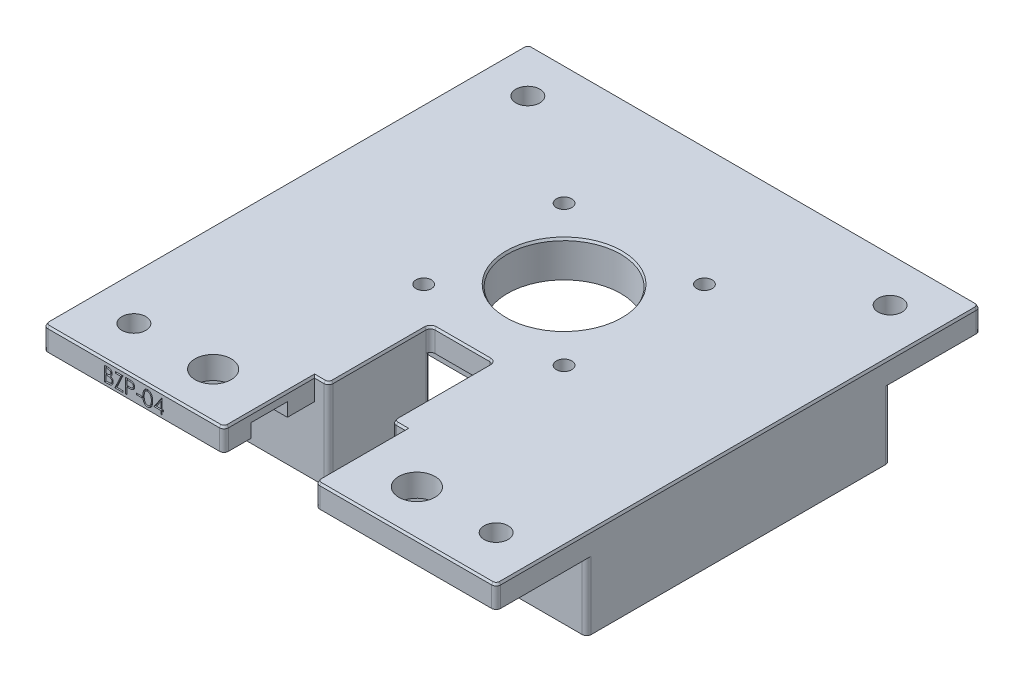
from build123d import *
from OCP.BRepFilletAPI import BRepFilletAPI_MakeChamfer

# Parameters (mm, degrees)
SKETCH2_W                  = 100
SKETCH2_H                  = 107
BOSS_EXTRUDE1_DEPTH        = 5
CUT_EXTRUDE1_DEPTH         = 147.540096902
CUT_EXTRUDE1_DEPTH_BACK    = 147.540096902
SKETCH3_R                  = 12.5
SKETCH3_R_2                = 1.7
SKETCH3_R_3                = 4
M5_CLEARANCE_HOLE1_D       = 5.3
FILLET1_R                  = 1
BOSS_EXTRUDE2_DEPTH        = 15
FILLET3_R                  = 3
FILLET4_R                  = 1
CUT_EXTRUDE2_DEPTH         = 4
CUT_EXTRUDE2_DEPTH_BACK    = 4
SKETCH12_R                 = 12.5
SKETCH12_R_2               = 1.7
BOSS_EXTRUDE3_DEPTH        = 3
CHAMFER2_SIZE              = 0.5
SKETCH10_W                 = 1.221153846
SKETCH10_H                 = 0.325641026
PART_NUM_DEPTH             = 0.4
PRINTABILITY_CHAMFER_SIZE  = 0.5
PRINTABILITY_CHAMFER_SIZE2 = 0.288675135


with BuildPart() as part:
    # Sketch2 → Boss-Extrude1 (new body)
    with BuildSketch(Plane(origin=(0, 0, 0), x_dir=(1, 0, 0), z_dir=(0, 1, 0))):
        with Locations((50, 53.5)):
            Rectangle(SKETCH2_W, SKETCH2_H)
    extrude(amount=BOSS_EXTRUDE1_DEPTH)

    # Sketch3 → Cut-Extrude1 (cut, two sides: drawn at the far end of the back side and taken through both)
    with BuildSketch(Plane(origin=(0, 5, 0), x_dir=(1, 0, 0), z_dir=(0, 1, 0)).offset(-CUT_EXTRUDE1_DEPTH_BACK)):
        with Locations((50, 65)):
            Circle(SKETCH3_R)
        with Locations((65.5, 49.5)):
            Circle(SKETCH3_R_2)
        with Locations((34.5, 49.5)):
            Circle(SKETCH3_R_2)
        with Locations((65.5, 80.5)):
            Circle(SKETCH3_R_2)
        with Locations((34.5, 80.5)):
            Circle(SKETCH3_R_2)
        with Locations((27.5, 10)):
            Circle(SKETCH3_R_3)
        with Locations((72.5, 10)):
            Circle(SKETCH3_R_3)
        Polygon((39.9, 0), (39.9, 20), (43, 20), (43, 42.5), (57, 42.5), (57, 20), (60.1, 20), (60.1, 0), align=None)
    extrude(amount=CUT_EXTRUDE1_DEPTH + CUT_EXTRUDE1_DEPTH_BACK, mode=Mode.SUBTRACT)

    # M5 Clearance Hole1 (through all)
    with Locations(Plane(origin=(0, 5, 0), x_dir=(1, 0, 0), z_dir=(0, 1, 0))):
        with Locations((10, 97), (10, 10), (90, 10), (90, 97)):
            Hole(M5_CLEARANCE_HOLE1_D / 2)

    # Fillet1
    fillet1_edges = [part.edges().sort_by_distance(p)[0] for p in [
        (60.1, 2.5, 0),
        (39.9, 2.5, 0),
        (0, 2.5, -107),
        (100, 2.5, -107),
        (100, 2.5, 0),
        (0, 2.5, 0),
        (57, 2.5, -42.5),
        (43, 2.5, -42.5),
    ]]
    fillet(fillet1_edges, radius=FILLET1_R)

    # Sketch7 → Boss-Extrude2 (add)
    with BuildSketch(Plane.XZ):
        Polygon((57, -20), (100, -20), (100, -87), (84, -87), (84, -82), (95, -82), (95, -25), (62, -25), (62, -42.5), (57, -42.5), (57, -25), align=None)
        Polygon((43, -25), (43, -20), (0, -20), (0, -87), (16, -87), (16, -82), (5, -82), (5, -25), (38, -25), (38, -42.5), (43, -42.5), align=None)
    extrude(amount=BOSS_EXTRUDE2_DEPTH)

    # Fillet3
    fillet3_edges = [part.edges().sort_by_distance(p)[0] for p in [
        (5, -7.5, -82),
        (95, -7.5, -82),
        (5, -7.5, -25),
        (38, -7.5, -25),
        (95, -7.5, -25),
        (62, -7.5, -25),
    ]]
    fillet(fillet3_edges, radius=FILLET3_R)

    # Fillet4
    fillet4_edges = [part.edges().sort_by_distance(p)[0] for p in [
        (100, -7.5, -87),
        (100, -7.5, -20),
        (43, -5, -20),
        (57, -5, -20),
        (84, -7.5, -87),
        (84, -7.5, -82),
        (0, -7.5, -20),
        (0, -7.5, -87),
        (16, -7.5, -87),
        (16, -7.5, -82),
        (38, -7.5, -42.5),
        (62, -7.5, -42.5),
        (57, -7.5, -42.5),
        (43, -7.5, -42.5),
    ]]
    fillet(fillet4_edges, radius=FILLET4_R)

    # Sketch9 → Cut-Extrude2 (cut, two sides: drawn at the far end of the back side and taken through both)
    with BuildSketch(Plane.XY.offset(-10).offset(-CUT_EXTRUDE2_DEPTH_BACK)):
        Polygon((39.9, 0), (39.9, 3), (36.9, 0), align=None)
        Polygon((60.1, 0), (63.1, 0), (60.1, 3), align=None)
    extrude(amount=CUT_EXTRUDE2_DEPTH + CUT_EXTRUDE2_DEPTH_BACK, mode=Mode.SUBTRACT)

    # Sketch12 → Boss-Extrude3 (add)
    with BuildSketch(Plane.XZ):
        with BuildLine():
            Line((34.5, -85.5), (65.5, -85.5))
            ThreePointArc((65.5, -85.5), (69.035533906, -84.035533906), (70.5, -80.5))
            Line((70.5, -80.5), (70.5, -49.5))
            ThreePointArc((70.5, -49.5), (69.035533906, -45.964466094), (65.5, -44.5))
            Line((65.5, -44.5), (34.5, -44.5))
            ThreePointArc((34.5, -44.5), (30.964466094, -45.964466094), (29.5, -49.5))
            Line((29.5, -49.5), (29.5, -80.5))
            ThreePointArc((29.5, -80.5), (30.964466094, -84.035533906), (34.5, -85.5))
        make_face()
        with Locations((50, -65)):
            Circle(SKETCH12_R, mode=Mode.SUBTRACT)
        with Locations((34.5, -49.5)):
            Circle(SKETCH12_R_2, mode=Mode.SUBTRACT)
        with Locations((65.5, -49.5)):
            Circle(SKETCH12_R_2, mode=Mode.SUBTRACT)
        with Locations((65.5, -80.5)):
            Circle(SKETCH12_R_2, mode=Mode.SUBTRACT)
        with Locations((34.5, -80.5)):
            Circle(SKETCH12_R_2, mode=Mode.SUBTRACT)
    extrude(amount=BOSS_EXTRUDE3_DEPTH)

    # Chamfer2
    chamfer2_edges = [part.edges().sort_by_distance(p)[0] for p in [
        (50, 0, -85.5),
        (69.035533906, 0, -84.035533906),
        (30.964466094, 0, -84.035533906),
        (70.5, 0, -65),
        (29.5, 0, -65),
        (69.035533906, 0, -45.964466094),
        (30.964466094, 0, -45.964466094),
        (50, 0, -44.5),
    ]]
    chamfer(chamfer2_edges, length=CHAMFER2_SIZE)

    # Sketch10 → Part Num (cut)
    # profile 1 of 6: a face of its own
    with BuildSketch(Plane(origin=(0, 5, 0), x_dir=(1, 0, 0), z_dir=(0, 0, -1))):
        with BuildLine():
            Line((13.559294872, 1.225), (14.178776042, 1.225))
            add(Edge.make_bspline(
                [(14.178776042, 1.225), (14.209100925, 1.225156921), (14.267878096, 1.225461072), (14.353342091, 1.230287737), (14.433418884, 1.236704332), (14.50796697, 1.247467824), (14.577471422, 1.258628146), (14.641226624, 1.275008826), (14.699766605, 1.293101885), (14.77006114, 1.32094051), (14.849819923, 1.364174247), (14.93554569, 1.428293986), (15.010063757, 1.505168377), (15.073426203, 1.592772808), (15.124275913, 1.68914761), (15.160598035, 1.792219247), (15.18393275, 1.900253662), (15.186302411, 1.974321243), (15.1875, 2.011753806)],
                knots=[0, 0, 0, 0, 1.00128172, 1.940733171, 2.826250472, 3.653024905, 4.427672124, 5.149348099, 5.824709082, 6.450061444, 7.643590664, 8.808605388, 9.972104426, 11.165284501, 12.367876273, 13.557044126, 14.765369432, 16, 16, 16, 16], degree=3))
            add(Edge.make_bspline(
                [(15.1875, 2.011753806), (15.186521793, 2.046821674), (15.184599523, 2.115733341), (15.165820503, 2.216186738), (15.137474028, 2.312110727), (15.096568342, 2.402580893), (15.044410156, 2.486802276), (14.980951884, 2.563338275), (14.905707767, 2.630686236), (14.849214068, 2.668166335), (14.820517829, 2.687204527)],
                knots=[0, 0, 0, 0, 1.044356178, 2.052258378, 3.035953355, 4.020338374, 5.002448483, 5.980768927, 6.974322109, 8, 8, 8, 8], degree=3))
            add(Edge.make_bspline(
                [(14.820517829, 2.687204527), (14.856588776, 2.701045853), (14.925601434, 2.727527739), (15.020694663, 2.77452874), (15.102651573, 2.825257679), (15.172528364, 2.880086384), (15.231080178, 2.940805168), (15.283240485, 3.005814962), (15.327507334, 3.077379834), (15.365276832, 3.153949009), (15.395196276, 3.235117005), (15.415964531, 3.320276589), (15.429135825, 3.40846321), (15.430858211, 3.468399436), (15.431730769, 3.498763021)],
                knots=[0, 0, 0, 0, 1.272200328, 2.434034374, 3.488177493, 4.442517805, 5.351202203, 6.260825393, 7.183200622, 8.11705787, 9.069326169, 10.026320267, 11.000137371, 12, 12, 12, 12], degree=3))
            add(Edge.make_bspline(
                [(15.431730769, 3.498763021), (15.430844545, 3.529757203), (15.429100875, 3.590739126), (15.41623883, 3.680324877), (15.394454675, 3.765933729), (15.364470848, 3.848135531), (15.325385419, 3.926448851), (15.27816616, 4.001489144), (15.22149309, 4.072144303), (15.157673639, 4.13943962), (15.086469492, 4.20097828), (15.008008094, 4.253862582), (14.924300327, 4.299540927), (14.834199915, 4.336263754), (14.73834618, 4.365011011), (14.636716669, 4.384886817), (14.529369089, 4.398332925), (14.455699174, 4.399434879), (14.41791867, 4.4)],
                knots=[0, 0, 0, 0, 0.978522333, 1.925270105, 2.85076145, 3.763600118, 4.682725947, 5.609499657, 6.557784645, 7.537954401, 8.534920712, 9.522742111, 10.520247711, 11.5409147, 12.58930695, 13.675078472, 14.807699069, 16, 16, 16, 16], degree=3))
            Line((14.41791867, 4.4), (13.559294872, 4.4))
            Line((13.559294872, 4.4), (13.559294872, 1.225))
        make_face()
        with BuildLine():
            Line((13.844230769, 1.550641026), (13.844230769, 2.568269231))
            Line((13.844230769, 2.568269231), (14.035672075, 2.568269231))
            add(Edge.make_bspline(
                [(14.035672075, 2.568269231), (14.063656592, 2.567909462), (14.11772838, 2.567214317), (14.196240951, 2.565160292), (14.26893695, 2.559660798), (14.336066859, 2.553844164), (14.397180797, 2.544887778), (14.452483186, 2.53392756), (14.502471365, 2.522437825), (14.560090796, 2.502841292), (14.625441111, 2.474182831), (14.694618633, 2.428618136), (14.756881512, 2.375864071), (14.808244794, 2.313289506), (14.85100659, 2.245714635), (14.879796447, 2.172635549), (14.899869806, 2.096570575), (14.901656804, 2.044112234), (14.902564103, 2.017477965)],
                knots=[0, 0, 0, 0, 1.156584208, 2.234756387, 3.244705828, 4.168772894, 5.018724976, 5.795346628, 6.498686023, 7.135894168, 8.308330183, 9.43588092, 10.547699294, 11.667188675, 12.76860303, 13.837480448, 14.902040606, 16, 16, 16, 16], degree=3))
            add(Edge.make_bspline(
                [(14.902564103, 2.017477965), (14.902121598, 1.999845497), (14.901253578, 1.965257486), (14.893070408, 1.914864741), (14.88177773, 1.866910763), (14.863153292, 1.822688306), (14.841088146, 1.780644538), (14.8128059, 1.742107543), (14.780193868, 1.706033348), (14.742172327, 1.673388889), (14.698896699, 1.64386386), (14.648996117, 1.619285683), (14.593827254, 1.597443357), (14.532239669, 1.580886362), (14.465460128, 1.566512255), (14.392469815, 1.557448022), (14.313708618, 1.551625016), (14.259137987, 1.550976338), (14.230929487, 1.550641026)],
                knots=[0, 0, 0, 0, 0.911412742, 1.787835618, 2.63643285, 3.453173233, 4.262886967, 5.08783453, 5.918594724, 6.773969545, 7.67442701, 8.62112486, 9.645634318, 10.739428598, 11.916091468, 13.177237585, 14.540865421, 16, 16, 16, 16], degree=3))
            Line((14.230929487, 1.550641026), (13.844230769, 1.550641026))
        make_face(mode=Mode.SUBTRACT)
        with BuildLine():
            Line((13.844230769, 2.893910256), (13.844230769, 4.074358974))
            Line((13.844230769, 4.074358974), (14.250010016, 4.074358974))
            add(Edge.make_bspline(
                [(14.250010016, 4.074358974), (14.279052852, 4.073977387), (14.335029091, 4.073241928), (14.415910647, 4.071496784), (14.490477252, 4.065022306), (14.55934975, 4.058814977), (14.622209475, 4.048674015), (14.679667845, 4.038854064), (14.730412484, 4.024403522), (14.789786642, 4.00451932), (14.856196042, 3.97274173), (14.92871824, 3.926010062), (14.99259521, 3.869087446), (15.046790344, 3.803544285), (15.091851221, 3.733014359), (15.123024449, 3.657358853), (15.143222926, 3.579104783), (15.145601826, 3.52559752), (15.146794872, 3.498763021)],
                knots=[0, 0, 0, 0, 1.16016216, 2.236059617, 3.229676189, 4.14889023, 4.996733752, 5.772278665, 6.474820656, 7.101410824, 8.271817372, 9.403828207, 10.537358096, 11.673541442, 12.791884111, 13.865947414, 14.929748409, 16, 16, 16, 16], degree=3))
            add(Edge.make_bspline(
                [(15.146794872, 3.498763021), (15.146551335, 3.481984403), (15.146068189, 3.448697807), (15.138473614, 3.399825141), (15.127934288, 3.352248989), (15.11240228, 3.306615593), (15.093612775, 3.262139153), (15.06882463, 3.220266851), (15.040863787, 3.17921625), (14.997556668, 3.126707986), (14.933707118, 3.066939881), (14.842942728, 3.009154389), (14.740317485, 2.961797377), (14.665709188, 2.941777202), (14.62716847, 2.931435296)],
                knots=[0, 0, 0, 0, 0.723354195, 1.435040621, 2.129761981, 2.824182007, 3.512608497, 4.209435533, 4.920062464, 5.654614313, 7.143585817, 8.671381114, 10.280521501, 12, 12, 12, 12], degree=3))
            add(Edge.make_bspline(
                [(14.62716847, 2.931435296), (14.611720661, 2.928300831), (14.578226627, 2.921504664), (14.523609473, 2.914335298), (14.461047138, 2.907904144), (14.390807025, 2.903271916), (14.31260978, 2.898299301), (14.226480524, 2.896434267), (14.132358367, 2.894157894), (14.067050921, 2.893994914), (14.033128005, 2.893910256)],
                knots=[0, 0, 0, 0, 0.634452549, 1.375623993, 2.216454381, 3.166361212, 4.209414599, 5.370755378, 6.634280627, 8, 8, 8, 8], degree=3))
            Line((14.033128005, 2.893910256), (13.844230769, 2.893910256))
        make_face(mode=Mode.SUBTRACT)
    # profile 2 of 6: a face of its own
    with BuildSketch(Plane(origin=(0, 5, 0), x_dir=(1, 0, 0), z_dir=(0, 0, -1))):
        Polygon((15.920192308, 1.550641026), (15.920192308, 1.225), (17.589102564, 1.225), (16.257281651, 4.074358974), (17.548397436, 4.074358974), (17.548397436, 4.4), (15.798076923, 4.4), (17.129897837, 1.550641026), align=None)
    # profile 3 of 6: a face of its own
    with BuildSketch(Plane(origin=(0, 5, 0), x_dir=(1, 0, 0), z_dir=(0, 0, -1))):
        with BuildLine():
            Line((18.199679487, 1.225), (18.822340745, 1.225))
            add(Edge.make_bspline(
                [(18.822340745, 1.225), (18.865167781, 1.225047077), (18.947226285, 1.22513728), (19.064896371, 1.227872085), (19.171766628, 1.23152487), (19.267606616, 1.236588444), (19.352711219, 1.242572494), (19.426695341, 1.250965415), (19.49014051, 1.259728683), (19.528155646, 1.268638102), (19.545492788, 1.272701322)],
                knots=[0, 0, 0, 0, 1.415646017, 2.712440637, 3.8905458, 4.950247383, 5.884950622, 6.709939814, 7.411656543, 8, 8, 8, 8], degree=3))
            add(Edge.make_bspline(
                [(19.545492788, 1.272701322), (19.56743964, 1.278708558), (19.610816194, 1.290581476), (19.673321301, 1.314358446), (19.732780513, 1.342564145), (19.789442546, 1.374662729), (19.842336712, 1.412170044), (19.89311447, 1.452921295), (19.940710937, 1.498564559), (19.984407421, 1.549039743), (20.024894101, 1.6026933), (20.058784353, 1.660893367), (20.08871078, 1.721620959), (20.112032716, 1.78635876), (20.130364655, 1.854252238), (20.143715825, 1.9254781), (20.152296908, 1.999882695), (20.153111145, 2.050738752), (20.153525641, 2.076627604)],
                knots=[0, 0, 0, 0, 0.999333726, 1.975119402, 2.933498163, 3.889020618, 4.832249799, 5.779334906, 6.747801194, 7.724875447, 8.710438469, 9.696133548, 10.679360639, 11.681339199, 12.714023775, 13.766351759, 14.862936069, 16, 16, 16, 16], degree=3))
            add(Edge.make_bspline(
                [(20.153525641, 2.076627604), (20.153143349, 2.102733159), (20.152395368, 2.15381044), (20.143418023, 2.228534326), (20.131325635, 2.299943151), (20.11273188, 2.367878582), (20.08837902, 2.431937173), (20.059811229, 2.493097862), (20.025354741, 2.550320136), (19.985762645, 2.603811736), (19.941719413, 2.65362287), (19.893411391, 2.699392577), (19.841033604, 2.740852941), (19.784752512, 2.77809691), (19.724019435, 2.810260821), (19.659755482, 2.839069233), (19.591402071, 2.863263695), (19.544101362, 2.875990965), (19.520052083, 2.882461939)],
                knots=[0, 0, 0, 0, 1.121902311, 2.195077645, 3.232258892, 4.234102512, 5.217864754, 6.176164875, 7.132989551, 8.084763148, 9.034132444, 9.988522005, 10.94243251, 11.903244335, 12.886203696, 13.894208494, 14.929344452, 16, 16, 16, 16], degree=3))
            add(Edge.make_bspline(
                [(19.520052083, 2.882461939), (19.500160632, 2.886688777), (19.456567361, 2.895952137), (19.384778108, 2.906363894), (19.301151672, 2.914902673), (19.205972588, 2.922871129), (19.0990189, 2.927093415), (18.980535909, 2.932051068), (18.850122628, 2.934390313), (18.759163431, 2.934538182), (18.711673678, 2.934615385)],
                knots=[0, 0, 0, 0, 0.601372724, 1.317943291, 2.144091499, 3.08771165, 4.142394186, 5.309582461, 6.595334295, 8, 8, 8, 8], degree=3))
            Line((18.711673678, 2.934615385), (18.484615385, 2.934615385))
            Line((18.484615385, 2.934615385), (18.484615385, 4.4))
            Line((18.484615385, 4.4), (18.199679487, 4.4))
            Line((18.199679487, 4.4), (18.199679487, 1.225))
        make_face()
        with BuildLine():
            Line((18.484615385, 1.550641026), (18.484615385, 2.608974359))
            Line((18.484615385, 2.608974359), (19.040494792, 2.615970553))
            add(Edge.make_bspline(
                [(19.040494792, 2.615970553), (19.067636896, 2.61598845), (19.120034167, 2.616022999), (19.195928006, 2.61234584), (19.266170464, 2.608345506), (19.330865252, 2.601876016), (19.389717084, 2.593985255), (19.44286845, 2.583435268), (19.490743523, 2.572674962), (19.545890306, 2.554003923), (19.607660485, 2.525836289), (19.674703005, 2.483764418), (19.73198534, 2.430764439), (19.781136336, 2.370529413), (19.81998684, 2.303449897), (19.848143485, 2.231877993), (19.865329717, 2.156085468), (19.86748988, 2.104277864), (19.868589744, 2.077899639)],
                knots=[0, 0, 0, 0, 1.160501667, 2.240324542, 3.248665471, 4.168823117, 5.020172044, 5.786515869, 6.485785279, 7.116517804, 8.272762037, 9.381837012, 10.485674779, 11.594342068, 12.695271952, 13.786226926, 14.872841088, 16, 16, 16, 16], degree=3))
            add(Edge.make_bspline(
                [(19.868589744, 2.077899639), (19.867440811, 2.052375996), (19.865156875, 2.001638153), (19.84828545, 1.927242072), (19.819688653, 1.856483828), (19.781104663, 1.789935981), (19.733131498, 1.729861051), (19.67698839, 1.678042247), (19.613548837, 1.636100993), (19.554996767, 1.608181099), (19.502597275, 1.591808252), (19.457302681, 1.579987886), (19.405900244, 1.571835631), (19.348876426, 1.564035455), (19.286304234, 1.557739017), (19.217785787, 1.553366568), (19.143549316, 1.550834445), (19.092014254, 1.55070706), (19.065299479, 1.550641026)],
                knots=[0, 0, 0, 0, 1.12039168, 2.227199994, 3.330242575, 4.460839274, 5.593542475, 6.693949254, 7.801736126, 8.92216649, 9.528704869, 10.210659466, 10.975987387, 11.81211542, 12.738540127, 13.736887663, 14.826846554, 16, 16, 16, 16], degree=3))
            Line((19.065299479, 1.550641026), (18.484615385, 1.550641026))
        make_face(mode=Mode.SUBTRACT)
    # profile 4 of 6: a face of its own
    with BuildSketch(Plane(origin=(0, 5, 0), x_dir=(1, 0, 0), z_dir=(0, 0, -1))):
        with Locations((21.130448718, 3.178846154)):
            Rectangle(SKETCH10_W, SKETCH10_H)
    # profile 5 of 6: a face of its own
    with BuildSketch(Plane(origin=(0, 5, 0), x_dir=(1, 0, 0), z_dir=(0, 0, -1))):
        with BuildLine():
            add(Edge.make_bspline(
                [(21.98525641, 2.813772035), (21.98555397, 2.762883691), (21.986131983, 2.664032348), (21.992562193, 2.519991994), (22.00324411, 2.384863731), (22.017883016, 2.258641095), (22.035697459, 2.141291485), (22.059478684, 2.033128559), (22.086523044, 1.933651525), (22.117867421, 1.842536591), (22.153233633, 1.758554174), (22.191732091, 1.680158454), (22.234864124, 1.607443081), (22.280257631, 1.539336681), (22.329501301, 1.476524658), (22.382423887, 1.419289299), (22.438559244, 1.366743659), (22.498172988, 1.319751782), (22.560696927, 1.278804629), (22.62428152, 1.241686961), (22.69074033, 1.212325862), (22.758434115, 1.187218741), (22.827908268, 1.167330508), (22.899193054, 1.15349668), (22.97235244, 1.144841944), (23.021728688, 1.144011104), (23.046769832, 1.143589744)],
                knots=[0, 0, 0, 0, 1.64625301, 3.197870201, 4.6634513, 6.030635694, 7.308242971, 8.501545196, 9.611429483, 10.641742253, 11.616230371, 12.55791849, 13.464870342, 14.34944951, 15.20427819, 16.044004467, 16.869007726, 17.689551165, 18.496129964, 19.285613293, 20.0683943, 20.843080271, 21.620342827, 22.403213977, 23.190190624, 24, 24, 24, 24], degree=3))
            add(Edge.make_bspline(
                [(23.046769832, 1.143589744), (23.072032833, 1.143940127), (23.122297314, 1.144637268), (23.196342984, 1.15444994), (23.269098905, 1.16711544), (23.339461226, 1.187428816), (23.408760362, 1.211736404), (23.475272984, 1.243809882), (23.541347339, 1.278692279), (23.603981757, 1.321245869), (23.665047641, 1.368274589), (23.722290531, 1.421664209), (23.777173708, 1.479937166), (23.827624258, 1.544393116), (23.875804419, 1.61404376), (23.919885225, 1.68947297), (23.960783476, 1.770513584), (23.99926795, 1.856789911), (24.032921607, 1.950606524), (24.062842398, 2.051378265), (24.087367548, 2.16001767), (24.107649417, 2.275919549), (24.123392008, 2.399658079), (24.134849199, 2.530982551), (24.140903329, 2.669975122), (24.142043239, 2.765005487), (24.142628205, 2.813772035)],
                knots=[0, 0, 0, 0, 0.810910589, 1.61342667, 2.396193133, 3.181089899, 3.963115317, 4.752255436, 5.550715454, 6.36105385, 7.181178335, 8.024612154, 8.872680183, 9.750181803, 10.651284446, 11.591556747, 12.554036451, 13.566402641, 14.62422919, 15.753422176, 16.94128843, 18.199818041, 19.531985927, 20.947085226, 22.433341622, 24, 24, 24, 24], degree=3))
            add(Edge.make_bspline(
                [(24.142628205, 2.813772035), (24.142029642, 2.86232526), (24.140860754, 2.957141006), (24.134986983, 3.0955172), (24.123084878, 3.226125067), (24.108578365, 3.349153833), (24.087662811, 3.46444268), (24.06437755, 3.572610751), (24.034675892, 3.672641678), (24.001820493, 3.765654117), (23.963871504, 3.851564969), (23.923281266, 3.932271074), (23.878542433, 4.007272206), (23.831286761, 4.077364331), (23.779881082, 4.141267492), (23.725740637, 4.200192302), (23.667942403, 4.253674679), (23.606562168, 4.301258682), (23.543335742, 4.344132824), (23.477248506, 4.380259022), (23.409847501, 4.411753694), (23.34043167, 4.437071727), (23.269443657, 4.457085732), (23.196627822, 4.470710162), (23.122287411, 4.48031367), (23.072029521, 4.481043462), (23.046769832, 4.481410256)],
                knots=[0, 0, 0, 0, 1.561431216, 3.049195289, 4.452146966, 5.778046447, 7.031138842, 8.218704273, 9.334037798, 10.384210803, 11.388620812, 12.352076869, 13.287433199, 14.19507451, 15.06813243, 15.922055533, 16.766344942, 17.596869952, 18.417486629, 19.220035357, 20.016159057, 20.807716045, 21.59340902, 22.384936649, 23.188266813, 24, 24, 24, 24], degree=3))
            add(Edge.make_bspline(
                [(23.046769832, 4.481410256), (23.021729561, 4.480985162), (22.972355034, 4.480146959), (22.899183041, 4.471546161), (22.828001615, 4.457521158), (22.758668454, 4.438475275), (22.691041682, 4.414269078), (22.625783708, 4.383479729), (22.562032943, 4.347768738), (22.500079347, 4.307141318), (22.441107289, 4.260581379), (22.384765226, 4.209094936), (22.332527872, 4.151355125), (22.283623806, 4.088283519), (22.237853656, 4.020005674), (22.194904275, 3.946733625), (22.156523059, 3.867574197), (22.120354959, 3.783135875), (22.088472503, 3.691351453), (22.060633331, 3.591533526), (22.037162377, 3.483001243), (22.018467433, 3.365749411), (22.003152106, 3.239959542), (21.992572724, 3.105431183), (21.986135198, 2.962452483), (21.985554685, 2.864236572), (21.98525641, 2.813772035)],
                knots=[0, 0, 0, 0, 0.810976328, 1.599087026, 2.383086309, 3.159618043, 3.926613167, 4.707144544, 5.494386734, 6.292609454, 7.104690378, 7.92621526, 8.762510248, 9.62398222, 10.509836085, 11.424023232, 12.373226806, 13.358118208, 14.398657954, 15.5185989, 16.713620699, 17.994156382, 19.364120462, 20.818119981, 22.365111093, 24, 24, 24, 24], degree=3))
        make_face()
        with BuildLine():
            add(Edge.make_bspline(
                [(22.270192308, 2.8125), (22.270303039, 2.854907579), (22.270517947, 2.937212362), (22.275969792, 3.056603995), (22.283558203, 3.168147672), (22.293104865, 3.271799855), (22.307402335, 3.367198295), (22.323623727, 3.454739556), (22.343080171, 3.534261741), (22.366214564, 3.606459314), (22.392565497, 3.672356193), (22.421290351, 3.733703321), (22.452405577, 3.791246897), (22.486625049, 3.844779303), (22.524439036, 3.894001546), (22.565003515, 3.939147401), (22.608554357, 3.980033045), (22.668828635, 4.02855602), (22.748014823, 4.079288538), (22.848296213, 4.122923324), (22.95138528, 4.150522248), (23.021375705, 4.154022264), (23.056310096, 4.155769231)],
                knots=[0, 0, 0, 0, 1.459193451, 2.832007961, 4.111736495, 5.306635028, 6.412683014, 7.430020708, 8.369596877, 9.227877302, 10.036669781, 10.810175692, 11.557788084, 12.286326232, 12.994037279, 13.69140682, 14.37267704, 15.047194847, 16.352618509, 17.594157723, 18.799169539, 20, 20, 20, 20], degree=3))
            add(Edge.make_bspline(
                [(23.056310096, 4.155769231), (23.091445086, 4.15423738), (23.161590435, 4.151179113), (23.264609334, 4.124487765), (23.363793146, 4.081096109), (23.44206796, 4.031522171), (23.501452796, 3.984009028), (23.544016751, 3.943546211), (23.583079196, 3.898226589), (23.620129066, 3.849332926), (23.654109723, 3.795926979), (23.685009876, 3.738266698), (23.713206907, 3.676191642), (23.729271542, 3.632857667), (23.737484976, 3.610702123)],
                knots=[0, 0, 0, 0, 1.353621445, 2.702441307, 4.075953605, 5.516772412, 6.261413105, 7.007624062, 7.778524365, 8.566925914, 9.372323995, 10.217594641, 11.088702136, 12, 12, 12, 12], degree=3))
            add(Edge.make_bspline(
                [(23.737484976, 3.610702123), (23.747056937, 3.582372288), (23.766492122, 3.524850574), (23.791539946, 3.435620689), (23.81126613, 3.342001039), (23.829012897, 3.244551112), (23.841126026, 3.14255224), (23.850875828, 3.03632002), (23.856618666, 2.925774356), (23.857330547, 2.850667471), (23.857692308, 2.8125)],
                knots=[0, 0, 0, 0, 0.884706709, 1.796334032, 2.740027952, 3.714592787, 4.726048262, 5.777819803, 6.87074269, 8, 8, 8, 8], degree=3))
            add(Edge.make_bspline(
                [(23.857692308, 2.8125), (23.857293324, 2.774333349), (23.856512731, 2.699661985), (23.851384165, 2.590417712), (23.843142984, 2.486477881), (23.831988727, 2.3877482), (23.816676293, 2.294404394), (23.798287574, 2.206312902), (23.776728944, 2.12349743), (23.752000438, 2.045744551), (23.724132152, 1.973333218), (23.693344682, 1.906107553), (23.66049502, 1.843704976), (23.624792036, 1.786326202), (23.586740867, 1.733636423), (23.544975229, 1.686848523), (23.502148043, 1.643686402), (23.441238722, 1.595298485), (23.362146126, 1.54557191), (23.263049334, 1.501055337), (23.160488426, 1.474709227), (23.091011168, 1.471055605), (23.056310096, 1.469230769)],
                knots=[0, 0, 0, 0, 1.313528337, 2.569860077, 3.762944266, 4.901481389, 5.988248151, 7.017139294, 7.997571128, 8.932104357, 9.823695246, 10.66607014, 11.475539426, 12.248954257, 12.990316782, 13.708962568, 14.405488541, 15.08007697, 16.381737273, 17.610043218, 18.806313575, 20, 20, 20, 20], degree=3))
            add(Edge.make_bspline(
                [(23.056310096, 1.469230769), (23.021187248, 1.471057764), (22.950877566, 1.474715083), (22.847243755, 1.500962383), (22.747553725, 1.545255295), (22.668627803, 1.595359976), (22.608575961, 1.643498484), (22.565841998, 1.684583683), (22.525512289, 1.72930733), (22.487879452, 1.778306398), (22.453868763, 1.831736727), (22.422375361, 1.888863145), (22.393879682, 1.950119145), (22.367429284, 2.015979603), (22.34454036, 2.08829581), (22.323960549, 2.167802136), (22.308076031, 2.255912716), (22.293971975, 2.351759147), (22.283310912, 2.455534565), (22.276022679, 2.567342293), (22.270501389, 2.687150117), (22.270297398, 2.769879843), (22.270192308, 2.8125)],
                knots=[0, 0, 0, 0, 1.207779899, 2.417760083, 3.652287919, 4.947299644, 5.621638849, 6.297435916, 6.984320042, 7.691843698, 8.42018894, 9.161205785, 9.934506883, 10.743085206, 11.601138371, 12.542248028, 13.566483018, 14.679455109, 15.87477181, 17.154161492, 18.533899613, 20, 20, 20, 20], degree=3))
        make_face(mode=Mode.SUBTRACT)
    # profile 6 of 6: a face of its own
    with BuildSketch(Plane(origin=(0, 5, 0), x_dir=(1, 0, 0), z_dir=(0, 0, -1))):
        Polygon((26.160712139, 1.143589744), (26.218589744, 1.143589744), (26.218589744, 3.341666667), (26.584935897, 3.341666667), (26.584935897, 3.667307692), (26.218589744, 3.667307692), (26.218589744, 4.4), (25.933653846, 4.4), (25.933653846, 3.667307692), (24.427564103, 3.667307692), align=None)
        Polygon((25.933653846, 3.341666667), (25.933653846, 1.962780449), (24.987259615, 3.341666667), align=None, mode=Mode.SUBTRACT)
    extrude(amount=PART_NUM_DEPTH, mode=Mode.SUBTRACT)

    # Printability Chamfer: one chamfer whose edges measure the first distance from different faces: ONE call of the kernel's chamfer builder (chamfer() names one face for all edges)
    printability_chamfer_edges_1 = [part.edges().sort_by_distance(p)[0] for p in [
        (59.05, 5, -20),
    ]]
    printability_chamfer_side_1 = [part.faces().sort_by_distance(p)[0] for p in [
        (78.173501199, -7.332134293, -20),
    ]]
    printability_chamfer_edges_2 = [part.edges().sort_by_distance(p)[0] for p in [
        (57.292893219, 5, -20.292893219),
    ]]
    printability_chamfer_side_2 = [part.faces().sort_by_distance(p)[0] for p in [
        (57.292893219, -5, -20.292893219),
    ]]
    printability_chamfer_edges_3 = [part.edges().sort_by_distance(p)[0] for p in [
        (57, 5, -31.25),
    ]]
    printability_chamfer_side_3 = [part.faces().sort_by_distance(p)[0] for p in [
        (57, -5, -31.25),
    ]]
    printability_chamfer_edges_4 = [part.edges().sort_by_distance(p)[0] for p in [
        (56.707106781, 5, -42.207106781),
    ]]
    printability_chamfer_side_4 = [part.faces().sort_by_distance(p)[0] for p in [
        (56.707106781, 2.5, -42.207106781),
    ]]
    printability_chamfer_edges_5 = [part.edges().sort_by_distance(p)[0] for p in [
        (50, 5, -42.5),
    ]]
    printability_chamfer_side_5 = [part.faces().sort_by_distance(p)[0] for p in [
        (50, 2.5, -42.5),
    ]]
    printability_chamfer_edges_6 = [part.edges().sort_by_distance(p)[0] for p in [
        (43.292893219, 5, -42.207106781),
    ]]
    printability_chamfer_side_6 = [part.faces().sort_by_distance(p)[0] for p in [
        (43.292893219, 2.5, -42.207106781),
    ]]
    printability_chamfer_edges_7 = [part.edges().sort_by_distance(p)[0] for p in [
        (43, 5, -31.25),
    ]]
    printability_chamfer_side_7 = [part.faces().sort_by_distance(p)[0] for p in [
        (43, -5, -31.25),
    ]]
    printability_chamfer_edges_8 = [part.edges().sort_by_distance(p)[0] for p in [
        (42.707106781, 5, -20.292893219),
    ]]
    printability_chamfer_side_8 = [part.faces().sort_by_distance(p)[0] for p in [
        (42.707106781, -5, -20.292893219),
    ]]
    printability_chamfer_edges_9 = [part.edges().sort_by_distance(p)[0] for p in [
        (40.95, 5, -20),
    ]]
    printability_chamfer_side_9 = [part.faces().sort_by_distance(p)[0] for p in [
        (21.826498801, -7.332134293, -20),
    ]]
    printability_chamfer_edges_10 = [part.edges().sort_by_distance(p)[0] for p in [
        (37.5, 5, -65),
    ]]
    printability_chamfer_side_10 = [part.faces().sort_by_distance(p)[0] for p in [
        (37.5, 2.5, -65),
    ]]
    printability_chamfer_edges_11 = [part.edges().sort_by_distance(p)[0] for p in [
        (60.1, 5, -10.5),
    ]]
    printability_chamfer_side_11 = [part.faces().sort_by_distance(p)[0] for p in [
        (60.1, 2.5, -1.196468827),
    ]]
    printability_chamfer_edges_12 = [part.edges().sort_by_distance(p)[0] for p in [
        (60.392893219, 5, -0.292893219),
    ]]
    printability_chamfer_side_12 = [part.faces().sort_by_distance(p)[0] for p in [
        (60.392893219, 2.5, -0.292893219),
    ]]
    printability_chamfer_edges_13 = [part.edges().sort_by_distance(p)[0] for p in [
        (80.05, 5, 0),
    ]]
    printability_chamfer_side_13 = [part.faces().sort_by_distance(p)[0] for p in [
        (80.05, 2.5, 0),
    ]]
    printability_chamfer_edges_14 = [part.edges().sort_by_distance(p)[0] for p in [
        (99.707106781, 5, -0.292893219),
    ]]
    printability_chamfer_side_14 = [part.faces().sort_by_distance(p)[0] for p in [
        (99.707106781, 2.5, -0.292893219),
    ]]
    printability_chamfer_edges_15 = [part.edges().sort_by_distance(p)[0] for p in [
        (100, 5, -53.5),
    ]]
    printability_chamfer_side_15 = [part.faces().sort_by_distance(p)[0] for p in [
        (100, -4, -53.5),
    ]]
    printability_chamfer_edges_16 = [part.edges().sort_by_distance(p)[0] for p in [
        (99.707106781, 5, -106.707106781),
    ]]
    printability_chamfer_side_16 = [part.faces().sort_by_distance(p)[0] for p in [
        (99.707106781, 2.5, -106.707106781),
    ]]
    printability_chamfer_edges_17 = [part.edges().sort_by_distance(p)[0] for p in [
        (50, 5, -107),
    ]]
    printability_chamfer_side_17 = [part.faces().sort_by_distance(p)[0] for p in [
        (50, 2.5, -107),
    ]]
    printability_chamfer_edges_18 = [part.edges().sort_by_distance(p)[0] for p in [
        (0.292893219, 5, -106.707106781),
    ]]
    printability_chamfer_side_18 = [part.faces().sort_by_distance(p)[0] for p in [
        (0.292893219, 2.5, -106.707106781),
    ]]
    printability_chamfer_edges_19 = [part.edges().sort_by_distance(p)[0] for p in [
        (0, 5, -53.5),
    ]]
    printability_chamfer_side_19 = [part.faces().sort_by_distance(p)[0] for p in [
        (0, -4, -53.5),
    ]]
    printability_chamfer_edges_20 = [part.edges().sort_by_distance(p)[0] for p in [
        (39.9, 5, -10.5),
    ]]
    printability_chamfer_side_20 = [part.faces().sort_by_distance(p)[0] for p in [
        (39.9, 2.5, -19.803531173),
    ]]
    printability_chamfer_edges_21 = [part.edges().sort_by_distance(p)[0] for p in [
        (0.292893219, 5, -0.292893219),
    ]]
    printability_chamfer_side_21 = [part.faces().sort_by_distance(p)[0] for p in [
        (0.292893219, 2.5, -0.292893219),
    ]]
    printability_chamfer_edges_22 = [part.edges().sort_by_distance(p)[0] for p in [
        (39.607106781, 5, -0.292893219),
    ]]
    printability_chamfer_side_22 = [part.faces().sort_by_distance(p)[0] for p in [
        (39.607106781, 2.5, -0.292893219),
    ]]
    printability_chamfer_edges_23 = [part.edges().sort_by_distance(p)[0] for p in [
        (19.95, 5, 0),
    ]]
    printability_chamfer_side_23 = [part.faces().sort_by_distance(p)[0] for p in [
        (19.95, 0.382283928, 0),
    ]]
    printability_chamfer = BRepFilletAPI_MakeChamfer(part.part.solid().wrapped)
    for e in printability_chamfer_edges_1:
        printability_chamfer.Add(PRINTABILITY_CHAMFER_SIZE, PRINTABILITY_CHAMFER_SIZE2, e.wrapped, printability_chamfer_side_1[0].wrapped)  # the first distance lies on this face
    for e in printability_chamfer_edges_2:
        printability_chamfer.Add(PRINTABILITY_CHAMFER_SIZE, PRINTABILITY_CHAMFER_SIZE2, e.wrapped, printability_chamfer_side_2[0].wrapped)  # the first distance lies on this face
    for e in printability_chamfer_edges_3:
        printability_chamfer.Add(PRINTABILITY_CHAMFER_SIZE, PRINTABILITY_CHAMFER_SIZE2, e.wrapped, printability_chamfer_side_3[0].wrapped)  # the first distance lies on this face
    for e in printability_chamfer_edges_4:
        printability_chamfer.Add(PRINTABILITY_CHAMFER_SIZE, PRINTABILITY_CHAMFER_SIZE2, e.wrapped, printability_chamfer_side_4[0].wrapped)  # the first distance lies on this face
    for e in printability_chamfer_edges_5:
        printability_chamfer.Add(PRINTABILITY_CHAMFER_SIZE, PRINTABILITY_CHAMFER_SIZE2, e.wrapped, printability_chamfer_side_5[0].wrapped)  # the first distance lies on this face
    for e in printability_chamfer_edges_6:
        printability_chamfer.Add(PRINTABILITY_CHAMFER_SIZE, PRINTABILITY_CHAMFER_SIZE2, e.wrapped, printability_chamfer_side_6[0].wrapped)  # the first distance lies on this face
    for e in printability_chamfer_edges_7:
        printability_chamfer.Add(PRINTABILITY_CHAMFER_SIZE, PRINTABILITY_CHAMFER_SIZE2, e.wrapped, printability_chamfer_side_7[0].wrapped)  # the first distance lies on this face
    for e in printability_chamfer_edges_8:
        printability_chamfer.Add(PRINTABILITY_CHAMFER_SIZE, PRINTABILITY_CHAMFER_SIZE2, e.wrapped, printability_chamfer_side_8[0].wrapped)  # the first distance lies on this face
    for e in printability_chamfer_edges_9:
        printability_chamfer.Add(PRINTABILITY_CHAMFER_SIZE, PRINTABILITY_CHAMFER_SIZE2, e.wrapped, printability_chamfer_side_9[0].wrapped)  # the first distance lies on this face
    for e in printability_chamfer_edges_10:
        printability_chamfer.Add(PRINTABILITY_CHAMFER_SIZE, PRINTABILITY_CHAMFER_SIZE2, e.wrapped, printability_chamfer_side_10[0].wrapped)  # the first distance lies on this face
    for e in printability_chamfer_edges_11:
        printability_chamfer.Add(PRINTABILITY_CHAMFER_SIZE, PRINTABILITY_CHAMFER_SIZE2, e.wrapped, printability_chamfer_side_11[0].wrapped)  # the first distance lies on this face
    for e in printability_chamfer_edges_12:
        printability_chamfer.Add(PRINTABILITY_CHAMFER_SIZE, PRINTABILITY_CHAMFER_SIZE2, e.wrapped, printability_chamfer_side_12[0].wrapped)  # the first distance lies on this face
    for e in printability_chamfer_edges_13:
        printability_chamfer.Add(PRINTABILITY_CHAMFER_SIZE, PRINTABILITY_CHAMFER_SIZE2, e.wrapped, printability_chamfer_side_13[0].wrapped)  # the first distance lies on this face
    for e in printability_chamfer_edges_14:
        printability_chamfer.Add(PRINTABILITY_CHAMFER_SIZE, PRINTABILITY_CHAMFER_SIZE2, e.wrapped, printability_chamfer_side_14[0].wrapped)  # the first distance lies on this face
    for e in printability_chamfer_edges_15:
        printability_chamfer.Add(PRINTABILITY_CHAMFER_SIZE, PRINTABILITY_CHAMFER_SIZE2, e.wrapped, printability_chamfer_side_15[0].wrapped)  # the first distance lies on this face
    for e in printability_chamfer_edges_16:
        printability_chamfer.Add(PRINTABILITY_CHAMFER_SIZE, PRINTABILITY_CHAMFER_SIZE2, e.wrapped, printability_chamfer_side_16[0].wrapped)  # the first distance lies on this face
    for e in printability_chamfer_edges_17:
        printability_chamfer.Add(PRINTABILITY_CHAMFER_SIZE, PRINTABILITY_CHAMFER_SIZE2, e.wrapped, printability_chamfer_side_17[0].wrapped)  # the first distance lies on this face
    for e in printability_chamfer_edges_18:
        printability_chamfer.Add(PRINTABILITY_CHAMFER_SIZE, PRINTABILITY_CHAMFER_SIZE2, e.wrapped, printability_chamfer_side_18[0].wrapped)  # the first distance lies on this face
    for e in printability_chamfer_edges_19:
        printability_chamfer.Add(PRINTABILITY_CHAMFER_SIZE, PRINTABILITY_CHAMFER_SIZE2, e.wrapped, printability_chamfer_side_19[0].wrapped)  # the first distance lies on this face
    for e in printability_chamfer_edges_20:
        printability_chamfer.Add(PRINTABILITY_CHAMFER_SIZE, PRINTABILITY_CHAMFER_SIZE2, e.wrapped, printability_chamfer_side_20[0].wrapped)  # the first distance lies on this face
    for e in printability_chamfer_edges_21:
        printability_chamfer.Add(PRINTABILITY_CHAMFER_SIZE, PRINTABILITY_CHAMFER_SIZE2, e.wrapped, printability_chamfer_side_21[0].wrapped)  # the first distance lies on this face
    for e in printability_chamfer_edges_22:
        printability_chamfer.Add(PRINTABILITY_CHAMFER_SIZE, PRINTABILITY_CHAMFER_SIZE2, e.wrapped, printability_chamfer_side_22[0].wrapped)  # the first distance lies on this face
    for e in printability_chamfer_edges_23:
        printability_chamfer.Add(PRINTABILITY_CHAMFER_SIZE, PRINTABILITY_CHAMFER_SIZE2, e.wrapped, printability_chamfer_side_23[0].wrapped)  # the first distance lies on this face
    add(Compound.cast(printability_chamfer.Shape()), mode=Mode.REPLACE)


solid = part.part
